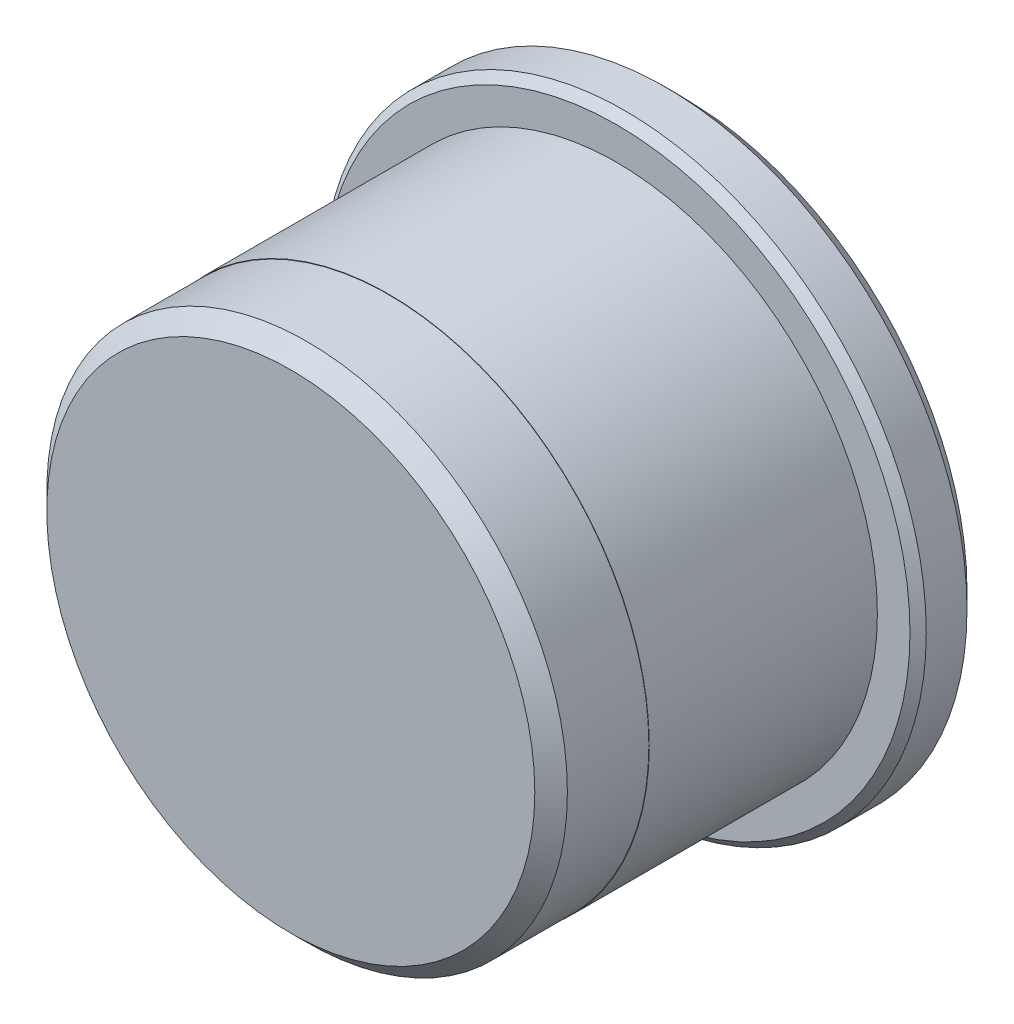
from build123d import *

# Parameters (mm, degrees)
SKETCH2_R          = 4
CUT_EXTRUDE3_DEPTH = 36.503520952
CIRPATTERN1_COUNT  = 3


with BuildPart() as part:
    # Sketch1 → Revolve2 (revolve)
    with BuildSketch(Plane(origin=(0, 0, 0), x_dir=(0, 0, -1), z_dir=(1, 0, 0))):
        Polygon((0, 0), (0, 14.975), (1, 15.975), (6, 15.975), (6, 16), (20, 16), (20, 18), (20.5, 18.5), (23, 18.5), (24, 17.5), (24, 14.077350269), (23, 13.5), (9, 13.5), (9, 13.75), (7, 13.75), (7, 11), (5, 11), (5, 1.5), (4.098709071, 0), align=None)
    revolve(axis=Axis((0, 0, 0), (0, 0, -1)))

    # Sketch2 → Cut-Extrude3 (cut, through all)
    with BuildSketch(Plane(origin=(0, 0, 0), x_dir=(0, 0, -1), z_dir=(0, 1, 0))):
        with Locations((27.3, 0)):
            Circle(SKETCH2_R)
    cut_extrude3 = extrude(amount=CUT_EXTRUDE3_DEPTH, mode=Mode.SUBTRACT)

    # CirPattern1: Cut-Extrude3 ×3 about axis
    cirpattern1_axis = Axis((0, 0, -4.098709071), (0, 0, 1))
    for i in range(1, CIRPATTERN1_COUNT):
        add(cut_extrude3.rotate(cirpattern1_axis, i * 360 / CIRPATTERN1_COUNT), mode=Mode.SUBTRACT)


solid = part.part
